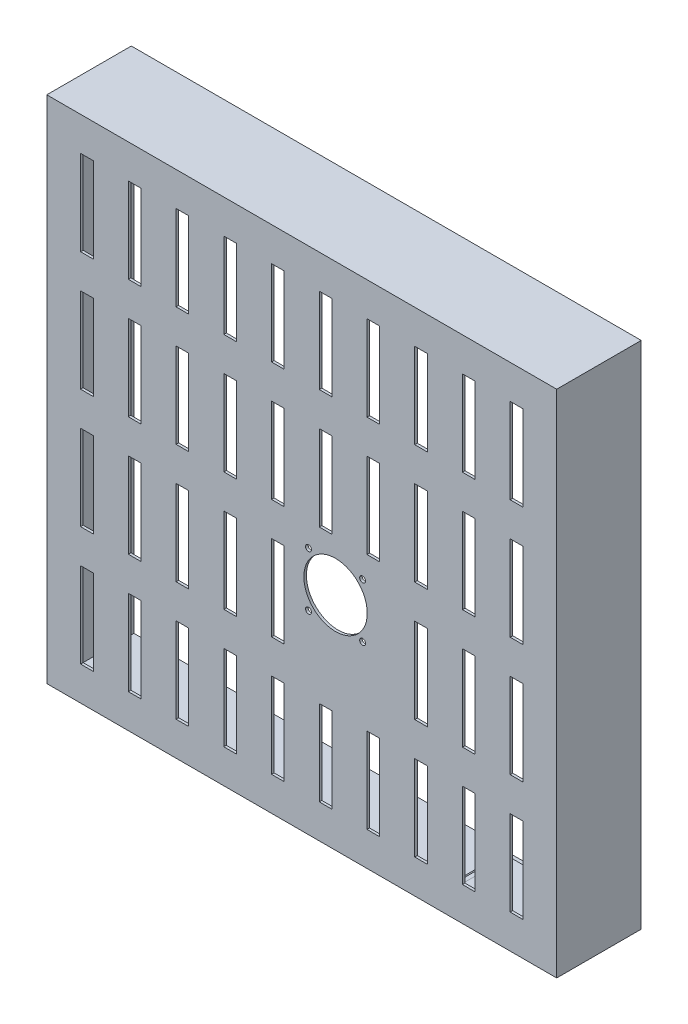
from build123d import *

# Parameters (mm, degrees)
THICKEN1_START          = -150.815
THICKEN1_DEPTH          = 301.63
THICKEN1_2_OUTLINE_W    = 298.63
THICKEN1_2_OUTLINE_H    = 48.5
THICKEN1_2_DEPTH        = 1.5
THICKEN1_START_2        = 149.315
THICKEN1_3_OUTLINE_W    = 298.63
THICKEN1_3_OUTLINE_H    = 48.5
THICKEN1_3_DEPTH        = 1.5
CUT_EXTRUDE1_DEPTH      = 3.5
CUT_EXTRUDE2_DEPTH      = 48.5
CUT_EXTRUDE3_DEPTH      = 220.066949698
CUT_EXTRUDE3_DEPTH_BACK = 220.066949698
SKETCH4_R               = 1.75
SKETCH4_R_2             = 18.75
CUT_EXTRUDE4_DEPTH      = 220.066949698
CUT_EXTRUDE4_DEPTH_BACK = 220.066949698
SKETCH5_W               = 7.5
SKETCH5_H               = 50.4075


# Read off the part's stored shape, not the designer's step: Thicken1
with BuildPart() as part:
    # Thicken1 outline → Thicken1 (new body)
    with BuildSketch(Plane.YZ.offset(THICKEN1_START)):
        Polygon((-150.815, 50), (-150.815, 0), (-149.315, 0), (-149.315, 48.5), (149.315, 48.5), (149.315, 0), (150.815, 0), (150.815, 50), align=None)
    extrude(amount=THICKEN1_DEPTH)

    # Thicken1 2 outline → Thicken1 2 (add)
    with BuildSketch(Plane.YZ.offset(THICKEN1_START)):
        with Locations((0, 24.25)):
            Rectangle(THICKEN1_2_OUTLINE_W, THICKEN1_2_OUTLINE_H)
    extrude(amount=THICKEN1_2_DEPTH)

    # Thicken1 3 outline → Thicken1 3 (add)
    with BuildSketch(Plane.YZ.offset(THICKEN1_START_2)):
        with Locations((0, 24.25)):
            Rectangle(THICKEN1_3_OUTLINE_W, THICKEN1_3_OUTLINE_H)
    extrude(amount=THICKEN1_3_DEPTH)

    # Sketch2 → Cut-Extrude1 (cut)
    with BuildSketch(Plane.XY):
        Polygon((147.166053391, -70.458946609), (145.751839828, -71.873160172), (148.8125, -74.933820344), (148.8125, -139.691179656), (139.691179656, -148.8125), (74.933820344, -148.8125), (71.873160172, -145.751839828), (70.458946609, -147.166053391), (74.105393219, -150.8125), (140.519606781, -150.8125), (150.8125, -140.519606781), (150.8125, -74.105393219), align=None)
    extrude(amount=CUT_EXTRUDE1_DEPTH, mode=Mode.SUBTRACT)

    # Sketch3 → Cut-Extrude2 (cut)
    with BuildSketch(Plane.XY):
        with BuildLine():
            Line((73.180697047, -143.737196171), (70.140927125, -146.776966094))
            Line((70.140927125, -146.776966094), (73.115800859, -149.751839828))
            Line((73.115800859, -149.751839828), (75.655768509, -149.751839828))
            ThreePointArc((75.655768509, -149.751839828), (76.458227012, -145.905044907), (73.180697047, -143.737196171))
        make_face()
    extrude(amount=CUT_EXTRUDE2_DEPTH, mode=Mode.SUBTRACT)

    # Sketch4 → Cut-Extrude3 (cut, two sides: drawn at the far end of the back side and taken through both)
    with BuildSketch(Plane.XY.offset(50).offset(-CUT_EXTRUDE3_DEPTH_BACK)):
        with Locations((36, -4)):
            Circle(SKETCH4_R)
        with Locations((4, -4)):
            Circle(SKETCH4_R)
        with Locations((36, -36)):
            Circle(SKETCH4_R)
        with Locations((4, -36)):
            Circle(SKETCH4_R)
        with Locations((20, -20)):
            Circle(SKETCH4_R_2)
    extrude(amount=CUT_EXTRUDE3_DEPTH + CUT_EXTRUDE3_DEPTH_BACK, mode=Mode.SUBTRACT)

    # Sketch5 → Cut-Extrude4 (cut, two sides: drawn at the far end of the back side and taken through both)
    with BuildSketch(Plane.XY.offset(50).offset(-CUT_EXTRUDE4_DEPTH_BACK)):
        with Locations((-127.065, 35.20375)):
            Rectangle(SKETCH5_W, SKETCH5_H)
        with Locations((-127.065, 105.61125)):
            Rectangle(SKETCH5_W, SKETCH5_H)
        with Locations((-127.065, -35.20375)):
            Rectangle(SKETCH5_W, SKETCH5_H)
        with Locations((-127.065, -105.61125)):
            Rectangle(SKETCH5_W, SKETCH5_H)
        with Locations((-98.828333333, 35.20375)):
            Rectangle(SKETCH5_W, SKETCH5_H)
        with Locations((-98.828333333, 105.61125)):
            Rectangle(SKETCH5_W, SKETCH5_H)
        with Locations((-98.828333333, -35.20375)):
            Rectangle(SKETCH5_W, SKETCH5_H)
        with Locations((-98.828333333, -105.61125)):
            Rectangle(SKETCH5_W, SKETCH5_H)
        with Locations((-70.591666667, 35.20375)):
            Rectangle(SKETCH5_W, SKETCH5_H)
        with Locations((-70.591666667, 105.61125)):
            Rectangle(SKETCH5_W, SKETCH5_H)
        with Locations((-70.591666667, -35.20375)):
            Rectangle(SKETCH5_W, SKETCH5_H)
        with Locations((-70.591666667, -105.61125)):
            Rectangle(SKETCH5_W, SKETCH5_H)
        with Locations((-42.355, 35.20375)):
            Rectangle(SKETCH5_W, SKETCH5_H)
        with Locations((-42.355, 105.61125)):
            Rectangle(SKETCH5_W, SKETCH5_H)
        with Locations((-42.355, -35.20375)):
            Rectangle(SKETCH5_W, SKETCH5_H)
        with Locations((-42.355, -105.61125)):
            Rectangle(SKETCH5_W, SKETCH5_H)
        with Locations((-14.118333333, 35.20375)):
            Rectangle(SKETCH5_W, SKETCH5_H)
        with Locations((-14.118333333, 105.61125)):
            Rectangle(SKETCH5_W, SKETCH5_H)
        with Locations((-14.118333333, -35.20375)):
            Rectangle(SKETCH5_W, SKETCH5_H)
        with Locations((-14.118333333, -105.61125)):
            Rectangle(SKETCH5_W, SKETCH5_H)
        with Locations((14.118333333, 35.20375)):
            Rectangle(SKETCH5_W, SKETCH5_H)
        with Locations((14.118333333, 105.61125)):
            Rectangle(SKETCH5_W, SKETCH5_H)
        with Locations((14.118333333, -105.61125)):
            Rectangle(SKETCH5_W, SKETCH5_H)
        with Locations((42.355, 35.20375)):
            Rectangle(SKETCH5_W, SKETCH5_H)
        with Locations((42.355, 105.61125)):
            Rectangle(SKETCH5_W, SKETCH5_H)
        with Locations((42.355, -105.61125)):
            Rectangle(SKETCH5_W, SKETCH5_H)
        with Locations((70.591666667, 35.20375)):
            Rectangle(SKETCH5_W, SKETCH5_H)
        with Locations((70.591666667, 105.61125)):
            Rectangle(SKETCH5_W, SKETCH5_H)
        with Locations((70.591666667, -35.20375)):
            Rectangle(SKETCH5_W, SKETCH5_H)
        with Locations((70.591666667, -105.61125)):
            Rectangle(SKETCH5_W, SKETCH5_H)
        with Locations((98.828333333, 35.20375)):
            Rectangle(SKETCH5_W, SKETCH5_H)
        with Locations((98.828333333, 105.61125)):
            Rectangle(SKETCH5_W, SKETCH5_H)
        with Locations((98.828333333, -35.20375)):
            Rectangle(SKETCH5_W, SKETCH5_H)
        with Locations((98.828333333, -105.61125)):
            Rectangle(SKETCH5_W, SKETCH5_H)
        with Locations((127.065, 35.20375)):
            Rectangle(SKETCH5_W, SKETCH5_H)
        with Locations((127.065, 105.61125)):
            Rectangle(SKETCH5_W, SKETCH5_H)
        with Locations((127.065, -35.20375)):
            Rectangle(SKETCH5_W, SKETCH5_H)
        with Locations((127.065, -105.61125)):
            Rectangle(SKETCH5_W, SKETCH5_H)
    extrude(amount=CUT_EXTRUDE4_DEPTH + CUT_EXTRUDE4_DEPTH_BACK, mode=Mode.SUBTRACT)


solid = part.part
